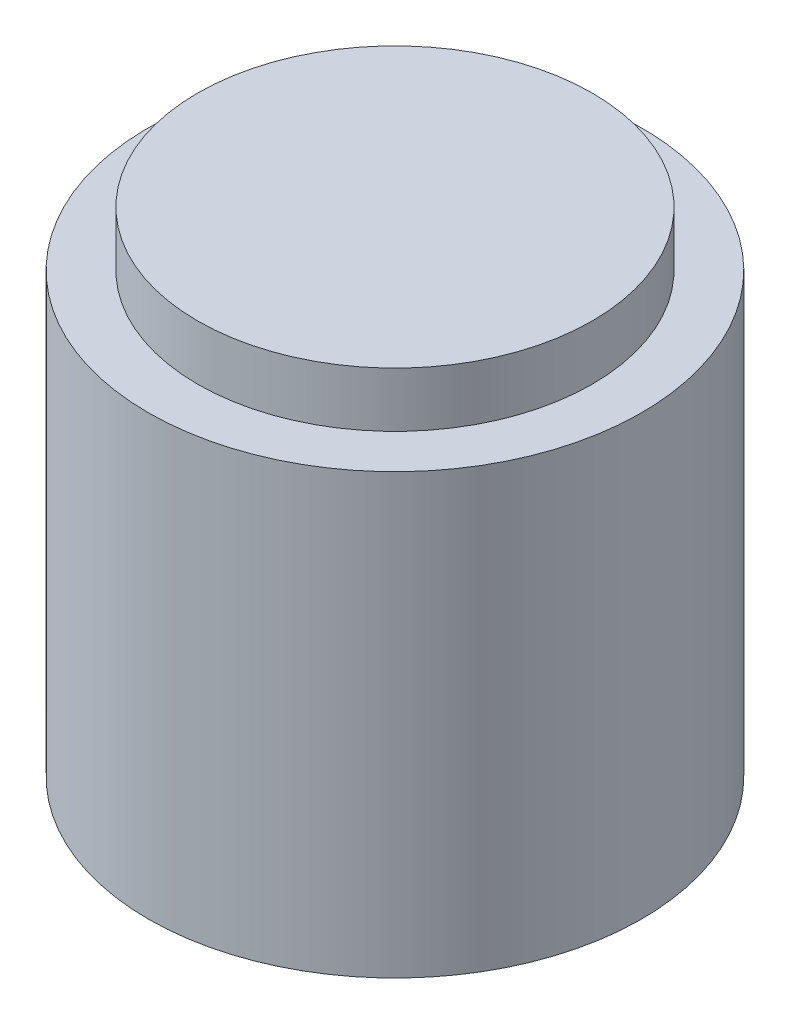
from build123d import *

# Parameters (mm, degrees)
SKETCH1_R                       = 7.14375
BOSS_EXTRUDE1_DEPTH             = 12.7
SKETCH3_R                       = 5.715
BOSS_EXTRUDE2_DEPTH             = 1.5875
F_1_4_0_25_DIAMETER_HOLE1_D     = 6.35
F_1_4_0_25_DIAMETER_HOLE1_DEPTH = 11.1125
F_1_4_0_25_DIAMETER_HOLE1_TIP   = 1.907732465


with BuildPart() as part:
    # Sketch1 → Boss-Extrude1 (new body)
    with BuildSketch(Plane(origin=(0, 0, 0), x_dir=(1, 0, 0), z_dir=(0, 1, 0))):
        Circle(SKETCH1_R)
    extrude(amount=BOSS_EXTRUDE1_DEPTH)

    # Sketch3 → Boss-Extrude2 (add)
    with BuildSketch(Plane(origin=(0, 12.7, 0), x_dir=(1, 0, 0), z_dir=(0, 1, 0))):
        Circle(SKETCH3_R)
    extrude(amount=BOSS_EXTRUDE2_DEPTH)

    # 1/4 (0.25) Diameter Hole1
    with Locations(Plane(origin=(0, 0, 0), x_dir=(-1, 0, 0), z_dir=(0, -1, 0))):
        with Locations((0, 0)):
            Hole(F_1_4_0_25_DIAMETER_HOLE1_D / 2, depth=F_1_4_0_25_DIAMETER_HOLE1_DEPTH)
            with Locations((0, 0, -(F_1_4_0_25_DIAMETER_HOLE1_DEPTH + F_1_4_0_25_DIAMETER_HOLE1_TIP / 2))):  # 118° drill point
                Cone(0, F_1_4_0_25_DIAMETER_HOLE1_D / 2, F_1_4_0_25_DIAMETER_HOLE1_TIP, mode=Mode.SUBTRACT)


solid = part.part
